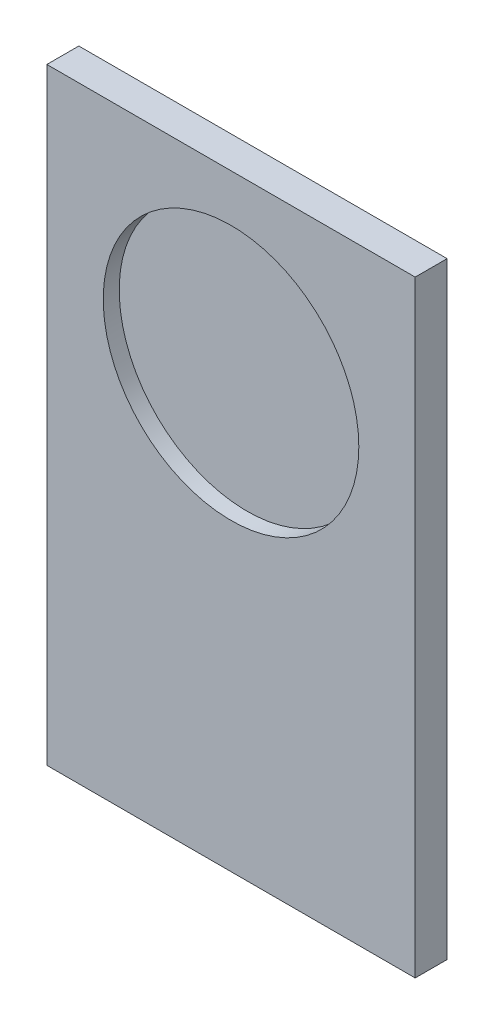
from build123d import *

# Parameters (mm, degrees)
SKETCH_1_W          = 57.64
SKETCH_1_H          = 125
EXTRUDE_1_DEPTH     = 5
CUT_EXTRUDE_1_DEPTH = 2.5
SKETCH_3_W          = 57.64
SKETCH_3_H          = 30
CUT_EXTRUDE_2_DEPTH = 10


with BuildPart() as part:
    # 스케치1 → 보스-돌출1 (new body)
    with BuildSketch(Plane.XY):
        Rectangle(SKETCH_1_W, SKETCH_1_H)
    extrude(amount=EXTRUDE_1_DEPTH)

    # 스케치2 → 컷-돌출1 (cut)
    with BuildSketch(Plane.XY.offset(5)):
        with BuildLine():
            ThreePointArc((-20, 5.10170356), (0, 25.10170356), (20, 5.10170356))
            ThreePointArc((20, 5.10170356), (0, -14.89829644), (-20, 5.10170356))
        make_face()
    extrude(amount=-CUT_EXTRUDE_1_DEPTH, mode=Mode.SUBTRACT)

    # 스케치3 → 컷-돌출2 (cut)
    with BuildSketch(Plane.XY.offset(5)):
        with Locations((0, 47.5)):
            Rectangle(SKETCH_3_W, SKETCH_3_H)
    extrude(amount=-CUT_EXTRUDE_2_DEPTH, mode=Mode.SUBTRACT)


solid = part.part
